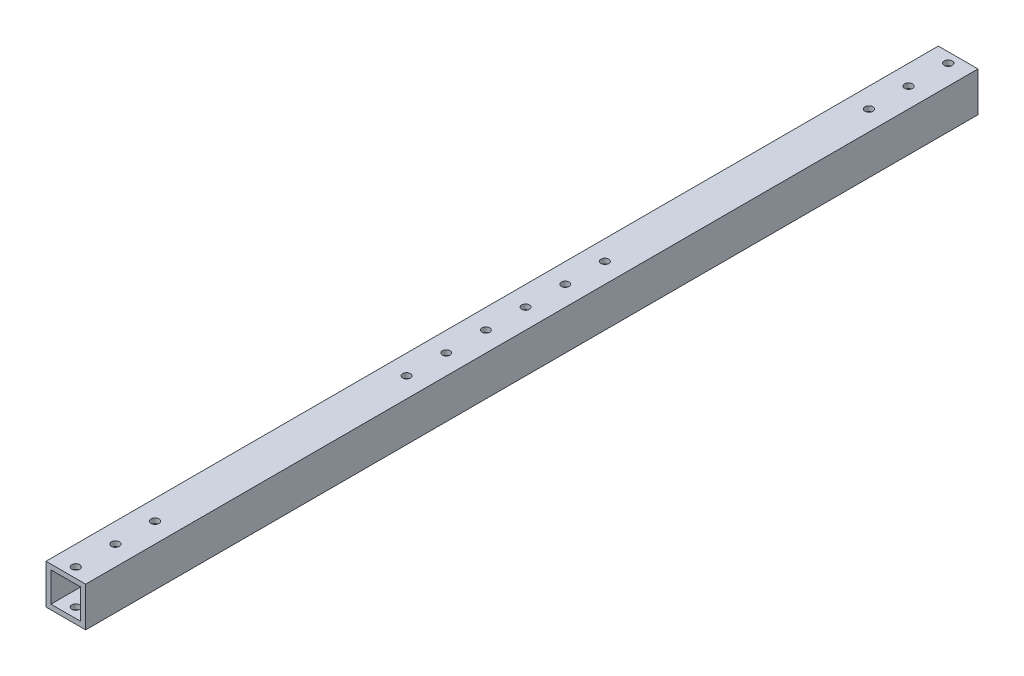
from build123d import *

# Parameters (mm, degrees)
SKETCH1_W                     = 25.4
SKETCH1_H                     = 25.4
SKETCH1_W_2                   = 19.05
SKETCH1_H_2                   = 19.05
EXTRUDE_THIN1_DEPTH           = 571.5
F_10_CLEARANCE_HOLE1_D        = 5.1054
F_3_16_0_195_DIAMETER_HOLE2_D = 4.953


with BuildPart() as part:
    # Sketch1 → Extrude-Thin1 (new body)
    with BuildSketch(Plane.XY):
        Rectangle(SKETCH1_W, SKETCH1_H)
        Rectangle(SKETCH1_W_2, SKETCH1_H_2, mode=Mode.SUBTRACT)
    extrude(amount=EXTRUDE_THIN1_DEPTH)

    # #10 Clearance Hole1 (through all)
    with Locations(Plane(origin=(0, 12.7, 565.15), x_dir=(0, 0, 1), z_dir=(0, 1, 0))):
        with Locations((0, 0), (-558.8, 0), (-533.4, 0), (-508, 0), (-25.4, 0), (-50.8, 0)):
            Hole(F_10_CLEARANCE_HOLE1_D / 2)

    # 3/16 (0.195) Diameter Hole2 (through all)
    with Locations(Plane(origin=(0, -12.7, 0), x_dir=(-1, 0, 0), z_dir=(0, -1, 0))):
        with Locations((0.080680797, -226.187), (0.080680797, -251.587), (0.080680797, -276.987), (0.080680797, -302.387), (0.080680797, -327.787), (0.080680797, -353.187)):
            Hole(F_3_16_0_195_DIAMETER_HOLE2_D / 2)


solid = part.part
